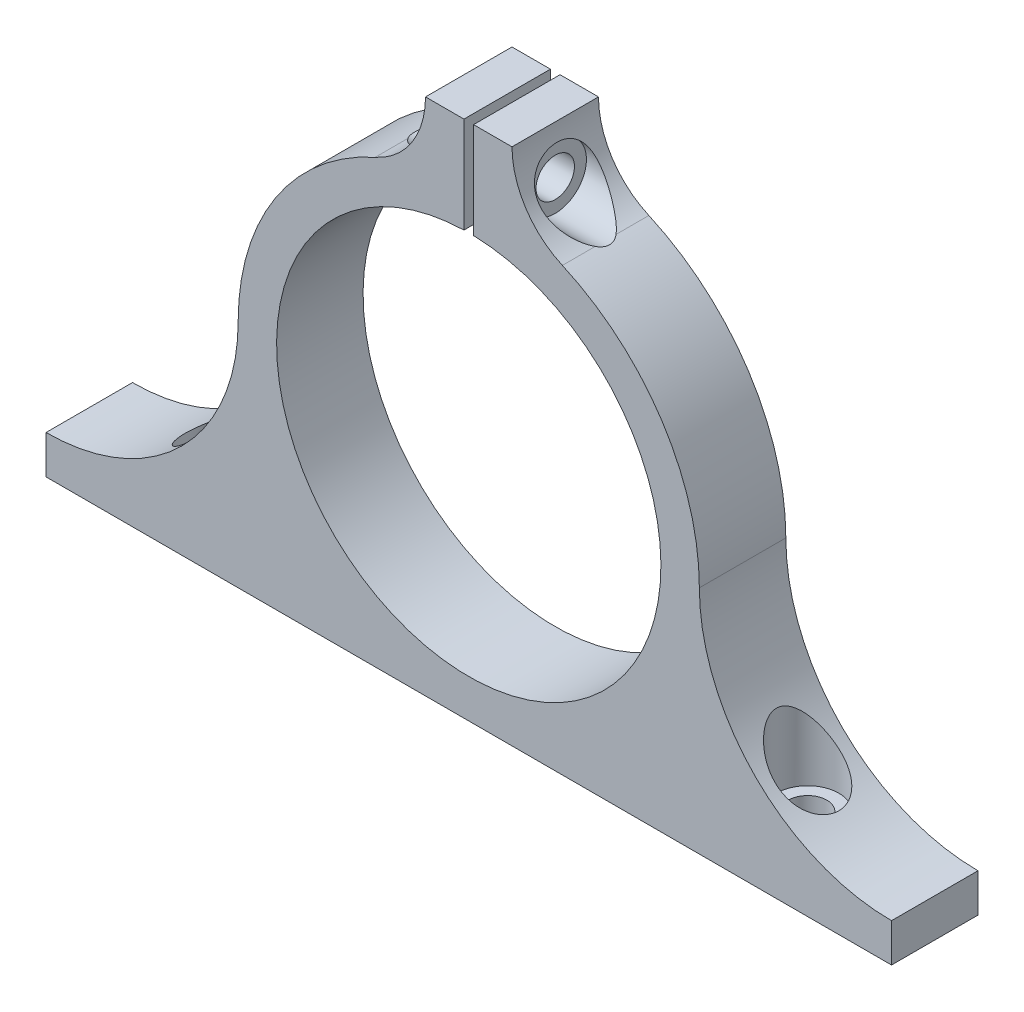
from build123d import *

# Parameters (mm, degrees)
BOSS_EXTRUDE1_DEPTH     = 18
SKETCH4_R               = 4
CUT_EXTRUDE2_DEPTH      = 141.470637501
SKETCH6_R               = 6.5
CUT_EXTRUDE3_DEPTH      = 133.936074943
CUT_EXTRUDE4_DEPTH      = 109.8347372
CUT_EXTRUDE4_DEPTH_BACK = 109.8347372
SKETCH7_R               = 4
SKETCH8_R               = 6.5
CUT_EXTRUDE5_DEPTH      = 18
CUT_EXTRUDE6_START      = -18
SKETCH10_R              = 6.5
CUT_EXTRUDE6_DEPTH      = 18


with BuildPart() as part:
    # Sketch1 → Boss-Extrude1 (new body)
    with BuildSketch(Plane.XY):
        with BuildLine():
            Line((88, -40), (88, -48))
            Line((88, -48), (-88, -48))
            Line((-88, -48), (-88, -40))
            ThreePointArc((-88, -40), (-59.715728753, -28.284271247), (-48, 0))
            ThreePointArc((-48, 0), (-40.245293582, 26.159440829), (-19.486818981, 43.866432337))
            ThreePointArc((-19.486818981, 43.866432337), (-11.852091543, 50.378859503), (-9, 60))
            Line((-9, 60), (-1, 60))
            Line((-1, 60), (-1, 39.987498046))
            ThreePointArc((-1, 39.987498046), (0, -40), (1, 39.987498046))
            Line((1, 39.987498046), (1, 60))
            Line((1, 60), (9, 60))
            ThreePointArc((9, 60), (11.852091543, 50.378859503), (19.486818981, 43.866432337))
            ThreePointArc((19.486818981, 43.866432337), (40.245293582, 26.159440829), (48, 0))
            ThreePointArc((48, 0), (59.715728753, -28.284271247), (88, -40))
        make_face()
    extrude(amount=BOSS_EXTRUDE1_DEPTH)

    # Sketch4 → Cut-Extrude2 (cut, through all)
    with BuildSketch(Plane.XZ.offset(48)):
        with Locations((-61.542486889, 9)):
            Circle(SKETCH4_R)
        with Locations((61.542486889, 9)):
            Circle(SKETCH4_R)
    extrude(amount=-CUT_EXTRUDE2_DEPTH, mode=Mode.SUBTRACT)

    # Sketch6 → Cut-Extrude3 (cut, through all)
    with BuildSketch(Plane(origin=(0, -38, 0), x_dir=(1, 0, 0), z_dir=(0, 1, 0))):
        with Locations((-61.542486889, -9)):
            Circle(SKETCH6_R)
        with Locations((61.542486889, -9)):
            Circle(SKETCH6_R)
    extrude(amount=CUT_EXTRUDE3_DEPTH, mode=Mode.SUBTRACT)

    # Sketch7 → Cut-Extrude4 (cut, two sides: drawn at the far end of the back side and taken through both)
    with BuildSketch(Plane.ZY.offset(-1).offset(-CUT_EXTRUDE4_DEPTH_BACK)):
        with Locations((9, 49.993749023)):
            Circle(SKETCH7_R)
    extrude(amount=CUT_EXTRUDE4_DEPTH + CUT_EXTRUDE4_DEPTH_BACK, mode=Mode.SUBTRACT)

    # Sketch8 → Cut-Extrude5 (cut)
    with BuildSketch(Plane(origin=(-9, 0, 0), x_dir=(0, 0, -1), z_dir=(1, 0, 0))):
        with Locations((-9, 49.993749023)):
            Circle(SKETCH8_R)
    extrude(amount=-CUT_EXTRUDE5_DEPTH, mode=Mode.SUBTRACT)

    # Sketch10 → Cut-Extrude6 (cut)
    with BuildSketch(Plane.ZY.offset(-9).offset(CUT_EXTRUDE6_START)):
        with Locations((9, 49.993749023)):
            Circle(SKETCH10_R)
    extrude(amount=CUT_EXTRUDE6_DEPTH, mode=Mode.SUBTRACT)


solid = part.part
